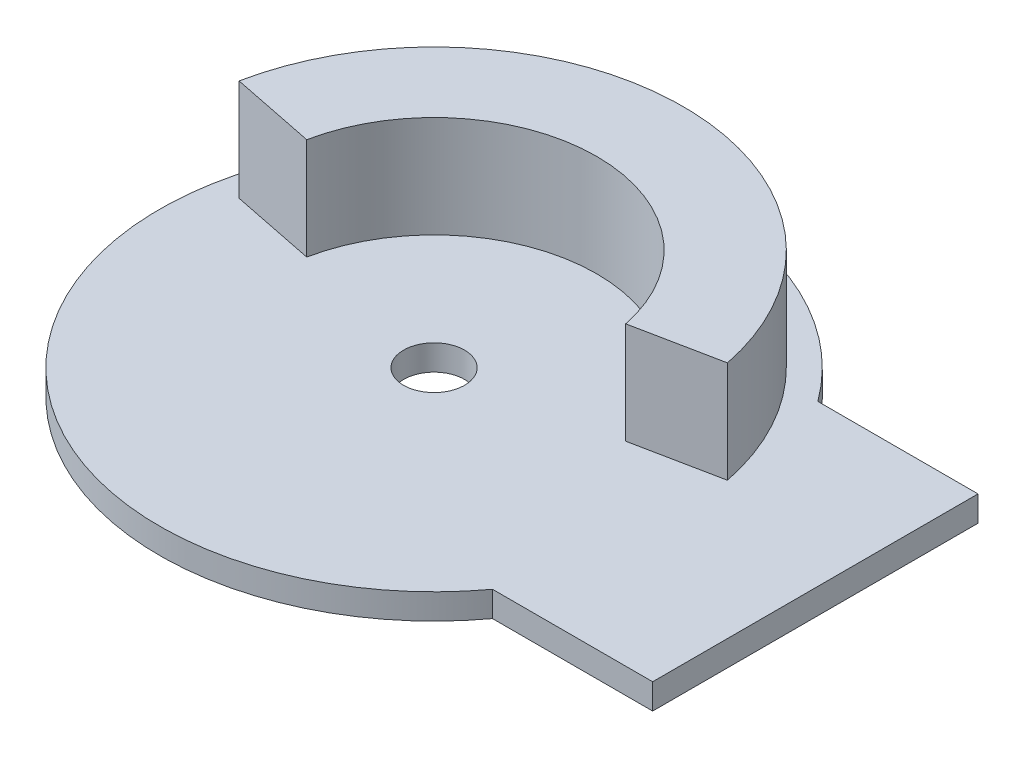
from build123d import *

# Parameters (mm, degrees)
BOSS_EXTRUDE1_DEPTH = 10
SKETCH2_R           = 3
BOSS_EXTRUDE2_DEPTH = 2.5


with BuildPart() as part:
    # Sketch1 → Boss-Extrude1 (new body)
    with BuildSketch(Plane(origin=(0, 0, 0), x_dir=(1, 0, 0), z_dir=(0, 1, 0))):
        with BuildLine():
            Line((-24.017268371, 4.839506173), (-15.684746691, 3.160493827))
            ThreePointArc((-15.684746691, 3.160493827), (0, 16), (15.684746691, 3.160493827))
            Line((15.684746691, 3.160493827), (24.017268371, 4.839506173))
            ThreePointArc((24.017268371, 4.839506173), (0, 24.5), (-24.017268371, 4.839506173))
        make_face()
    extrude(amount=BOSS_EXTRUDE1_DEPTH)

    # Sketch2 → Boss-Extrude2 (add)
    with BuildSketch(Plane.XZ):
        with BuildLine():
            Line((37.5, -16), (37.5, 16))
            Line((37.5, 16), (21.748563171, 16))
            ThreePointArc((21.748563171, 16), (12.186057607, 24.093567606), (0, 27))
            ThreePointArc((0, 27), (-27, 0), (0, -27))
            ThreePointArc((0, -27), (12.186057607, -24.093567606), (21.748563171, -16))
            Line((21.748563171, -16), (37.5, -16))
        make_face()
        Circle(SKETCH2_R, mode=Mode.SUBTRACT)
    extrude(amount=BOSS_EXTRUDE2_DEPTH)


solid = part.part
